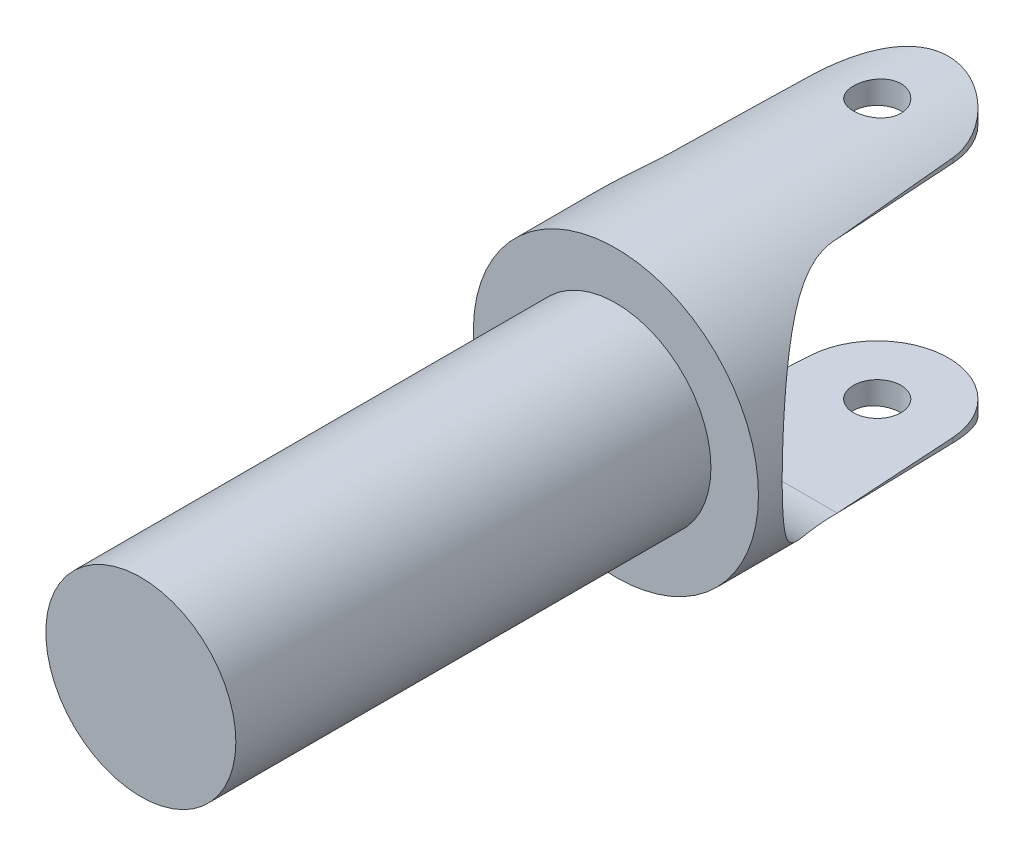
from build123d import *
from build123d.topology import SkipClean

# Parameters (mm, degrees)
BASE_SKETCH_R                   = 30
BASE_EXTRUDE_DEPTH              = 30
PIN_SKETCH_R                    = 20
PIN_EXTRUDE_DEPTH               = 100
SIDE_CUT_REACH                  = 138.748
SIDE_CUT_END_RADIUS             = 30
SIDE_CUT_SKETCH_R               = 25
SIDE_CUT_DIRECTION_2_REACH      = 138.748
SIDE_CUT_DIRECTION_2_END_RADIUS = 30
WING_EXTRUDE_REACH              = 146.309
WING_EXTRUDE_END_RADIUS         = 30
PIN_HOLE_CUT_DEPTH              = 145.308696956
PIN_HOLE_CUT_DEPTH_BACK         = 145.308696956
PIN_HOLE_SKETCH_R               = 5


with BuildPart() as part:
    # Base Sketch → Base Extrude (new body)
    with BuildSketch(Plane.XY):
        Circle(BASE_SKETCH_R)
    extrude(amount=BASE_EXTRUDE_DEPTH)

    # Pin Sketch → Pin Extrude (add)
    with BuildSketch(Plane.XY.offset(30)):
        Circle(PIN_SKETCH_R)
    extrude(amount=PIN_EXTRUDE_DEPTH)

    # Side Cut: up to this cylinder (the profile starts inside it)
    side_cut_end = Plane(origin=(0, 0, 0), z_dir=(0, 0, -1)) * Cylinder(SIDE_CUT_END_RADIUS, 338.496, mode=Mode.PRIVATE)
    # Side Cut Sketch → Side Cut (cut, up to the surface)
    with BuildSketch(Plane(origin=(0, 0, 0), x_dir=(0, 0, -1), z_dir=(1, 0, 0)), mode=Mode.PRIVATE) as side_cut_sk1:
        Circle(SIDE_CUT_SKETCH_R)
    side_cut_tool1 = extrude(side_cut_sk1.sketch, amount=-SIDE_CUT_REACH, mode=Mode.PRIVATE) & side_cut_end
    add(side_cut_tool1.solids().sort_by_distance((0, 0, 0))[0], mode=Mode.SUBTRACT)

    # Side Cut direction 2: up to this cylinder (the profile starts inside it)
    side_cut_direction_2_end = Plane(origin=(0, 0, 0), z_dir=(0, 0, -1)) * Cylinder(SIDE_CUT_DIRECTION_2_END_RADIUS, 338.496, mode=Mode.PRIVATE)
    # Side Cut Sketch → Side Cut direction 2 (cut, up to the surface)
    with BuildSketch(Plane(origin=(0, 0, 0), x_dir=(0, 0, -1), z_dir=(1, 0, 0)), mode=Mode.PRIVATE) as side_cut_direction_2_sk1:
        Circle(SIDE_CUT_SKETCH_R)
    side_cut_direction_2_tool1 = extrude(side_cut_direction_2_sk1.sketch, amount=SIDE_CUT_DIRECTION_2_REACH, mode=Mode.PRIVATE) & side_cut_direction_2_end
    add(side_cut_direction_2_tool1.solids().sort_by_distance((0, 0, 0))[0], mode=Mode.SUBTRACT)

    # Wing Extrude: up to this cylinder (the profile starts inside it)
    with SkipClean():  # the faces are left unmerged after this step: merging them gives an invalid solid
        wing_extrude_end = Plane(origin=(0, 0, -18.188486), z_dir=(0, 0, -1)) * Cylinder(WING_EXTRUDE_END_RADIUS, 353.618, mode=Mode.PRIVATE)
        # Wing Sketch → Wing Extrude (add, up to the surface)
        with BuildSketch(Plane(origin=(0, 25, 0), x_dir=(1, 0, 0), z_dir=(0, 1, 0)), mode=Mode.PRIVATE) as wing_extrude_sk1:
            with BuildLine():
                Line((-16.583123952, 0), (-14.971098535, 25.930703308))
                ThreePointArc((-14.971098535, 25.930703308), (0, 40), (14.971098535, 25.930703308))
                Line((14.971098535, 25.930703308), (16.583123952, 0))
                Line((16.583123952, 0), (-16.583123952, 0))
            make_face()
        wing_extrude_tool1 = extrude(wing_extrude_sk1.sketch, amount=WING_EXTRUDE_REACH, mode=Mode.PRIVATE) & wing_extrude_end
        wing_extrude = wing_extrude_tool1.solids().sort_by_distance((0, 25, -18.188486))[0]
        add(wing_extrude)

    # Wing Mirror: Wing Extrude across plane
    with SkipClean():  # the faces are left unmerged after this step: merging them gives an invalid solid
        add(wing_extrude.mirror(Plane.ZX))

    # Pin Hole Sketch → Pin Hole Cut (cut, two sides: drawn at the far end of the back side and taken through both)
    with SkipClean():  # the faces are left unmerged after this step: merging them gives an invalid solid
        with BuildSketch(Plane.XZ.offset(-25).offset(-PIN_HOLE_CUT_DEPTH_BACK)):
            with Locations((0, -25)):
                Circle(PIN_HOLE_SKETCH_R)
        extrude(amount=PIN_HOLE_CUT_DEPTH + PIN_HOLE_CUT_DEPTH_BACK, mode=Mode.SUBTRACT)


solid = part.part
